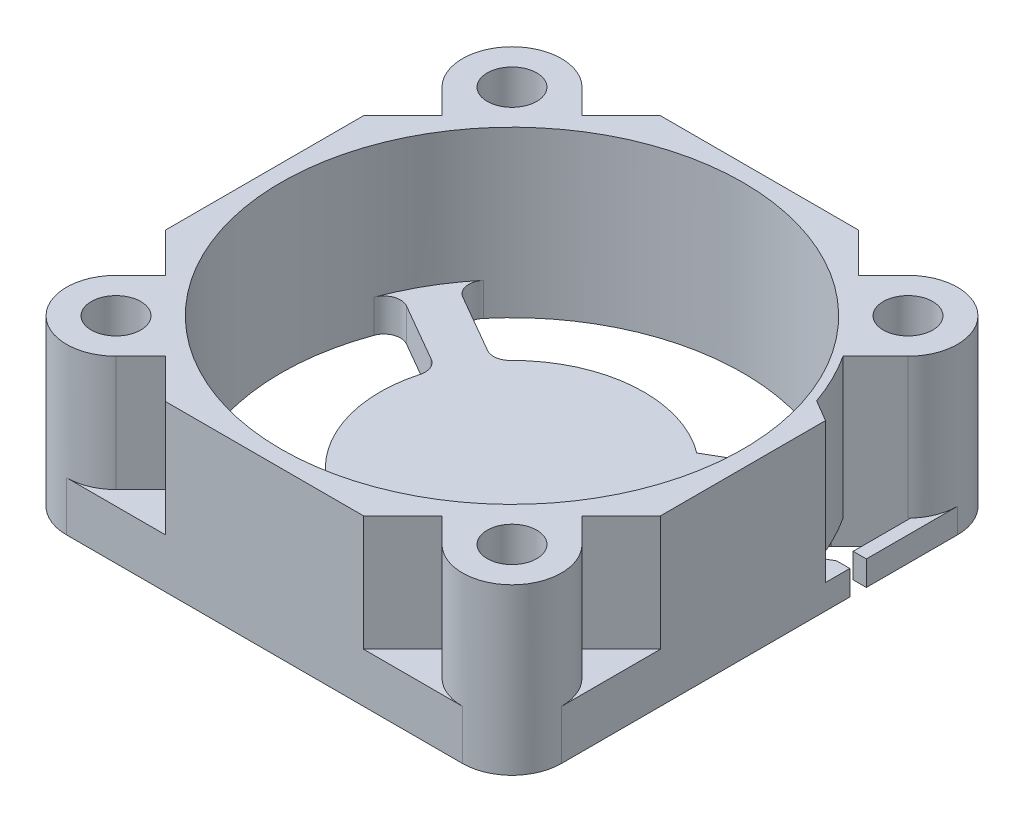
from build123d import *

# Parameters (mm, degrees)
SKETCH2_W           = 30
SKETCH2_H           = 30
BOSS_EXTRUDE1_DEPTH = 10
SKETCH3_R           = 1.5
CUT_EXTRUDE1_DEPTH  = 24.452078799
CUT_EXTRUDE5_DEPTH  = 7
CIRPATTERN2_COUNT   = 4
BOSS_EXTRUDE2_START = -2
SKETCH5_R           = 8
BOSS_EXTRUDE2_DEPTH = 2
BOSS_EXTRUDE3_START = -2
BOSS_EXTRUDE3_DEPTH = 2
FILLET1_R           = 1
FILLET2_R           = 1
CUT_EXTRUDE8_DEPTH  = 1.5
CUT_EXTRUDE9_DEPTH  = 23.852789764


with BuildPart() as part:
    # Sketch2 → Boss-Extrude1 (new body)
    with BuildSketch(Plane(origin=(0, 0, 0), x_dir=(1, 0, 0), z_dir=(0, 1, 0))):
        Rectangle(SKETCH2_W, SKETCH2_H)
    extrude(amount=BOSS_EXTRUDE1_DEPTH)

    # Sketch3 → Cut-Extrude1 (cut, through all)
    with BuildSketch(Plane(origin=(0, 10, 0), x_dir=(1, 0, 0), z_dir=(0, 1, 0))):
        with BuildLine():
            ThreePointArc((9.626607334, 10.165059333), (-12.860258603, -5.532969245), (14, 0))
            ThreePointArc((14, 0), (13.005976139, 5.181175993), (10.165059333, 9.626607334))
            ThreePointArc((10.165059333, 9.626607334), (9.878679656, 9.878679656), (9.626607334, 10.165059333))
        make_face()
        with BuildLine():
            Line((15, 15), (12, 15))
            ThreePointArc((12, 15), (14.121320344, 14.121320344), (15, 12))
            Line((15, 12), (15, 15))
        make_face()
        with Locations(Location((12, 12, 0), (0, 0, 270))):
            Circle(SKETCH3_R)
    cut_extrude1 = extrude(amount=-CUT_EXTRUDE1_DEPTH, mode=Mode.SUBTRACT)

    # Sketch3<3> → Cut-Extrude5 (cut)
    with BuildSketch(Plane(origin=(0, 10, 0), x_dir=(1, 0, 0), z_dir=(0, 1, 0))):
        with BuildLine():
            Line((15, 6), (15, 12))
            ThreePointArc((15, 12), (14.771638598, 10.851949703), (14.121320344, 9.878679656))
            Line((14.121320344, 9.878679656), (12.621320344, 8.378679656))
            Line((12.621320344, 8.378679656), (15, 6))
        make_face()
        with BuildLine():
            Line((8.378679656, 12.621320344), (9.878679656, 14.121320344))
            ThreePointArc((9.878679656, 14.121320344), (10.851949703, 14.771638598), (12, 15))
            Line((12, 15), (6, 15))
            Line((6, 15), (8.378679656, 12.621320344))
        make_face()
    cut_extrude5 = extrude(amount=-CUT_EXTRUDE5_DEPTH, mode=Mode.SUBTRACT)

    # CirPattern2: Cut-Extrude1, Cut-Extrude5 ×4 about axis
    cirpattern2_axis = Axis((0, 0, 0), (0, 1, 0))
    add([cut_extrude1.rotate(cirpattern2_axis, i * 360 / CIRPATTERN2_COUNT) for i in range(1, CIRPATTERN2_COUNT)], mode=Mode.SUBTRACT)
    add([cut_extrude5.rotate(cirpattern2_axis, i * 360 / CIRPATTERN2_COUNT) for i in range(1, CIRPATTERN2_COUNT)], mode=Mode.SUBTRACT)

    # Sketch5 → Boss-Extrude2 (add)
    with BuildSketch(Plane.XZ.offset(BOSS_EXTRUDE2_START)):
        Circle(SKETCH5_R)
        with BuildLine():
            Line((-1.25, 7.901740315), (-1.25, 13.944084767))
            ThreePointArc((-1.25, 13.944084767), (0, 14), (1.25, 13.944084767))
            Line((1.25, 13.944084767), (1.25, 7.901740315))
            Line((1.25, 7.901740315), (-1.25, 7.901740315))
        make_face()
        with BuildLine():
            Line((-6.218107847, -5.033401912), (-11.450931641, -8.054574138))
            ThreePointArc((-11.450931641, -8.054574138), (-12.124355653, -7), (-12.700931641, -5.889510629))
            Line((-12.700931641, -5.889510629), (-7.468107847, -2.868338403))
            Line((-7.468107847, -2.868338403), (-6.218107847, -5.033401912))
        make_face()
        with BuildLine():
            Line((4.800907132, -6.399319551), (10.244405826, -9.542124987))
            ThreePointArc((10.244405826, -9.542124987), (11.062646674, -8.580084415), (11.790860146, -7.548219459))
            Line((11.790860146, -7.548219459), (6.585131773, -4.542690781))
            Line((6.585131773, -4.542690781), (4.800907132, -6.399319551))
        make_face()
    extrude(amount=BOSS_EXTRUDE2_DEPTH)

    # Sketch13 → Boss-Extrude3 (add)
    with BuildSketch(Plane.XZ.offset(BOSS_EXTRUDE3_START)):
        with BuildLine():
            Line((8.467510381, -8.516233923), (11.717510381, -2.887068799))
            Line((11.717510381, -2.887068799), (13.449561188, -3.887068799))
            ThreePointArc((13.449561188, -3.887068799), (12.179734535, -6.903192498), (10.244405826, -9.542124987))
            Line((10.244405826, -9.542124987), (8.467510381, -8.516233923))
        make_face()
    extrude(amount=BOSS_EXTRUDE3_DEPTH)

    # Fillet1
    # the kernel refuses this fillet: 1 mm, written as the material it adds along each edge
    with BuildSketch(Plane(origin=(10.244405826, 2, -9.542124987), x_dir=(-0.716571272890301, 0, -0.6975138786206146), z_dir=(0, -1, 0))) as fillet1_piece_1:
        with BuildLine():
            CenterArc((1.321230175, -0.998801992), FILLET1_R, 87.19514232, 108.576976785)
            Line((0.3588798, -1.270613979), (0, 0))
            ThreePointArc((0, 0), (0.685082313, 0.01677211), (1.370164625, 0))
        make_face()
    extrude(amount=2)
    with BuildSketch(Plane(origin=(-1.25, 2, 13.944084767), x_dir=(0, 0, -1), z_dir=(0, -1, 0)), Plane(origin=(-11.450931641, 2, -8.054574138), x_dir=(0.8660254037844306, 0, 0.5000000000000138), z_dir=(0, -1, 0))) as fillet1_piece_2:
        with BuildLine():
            CenterArc((1.14027674, -1), FILLET1_R, 90, 99.9667663)
            ThreePointArc((0.15536843, -1.173076923), (0.065284688, -0.58818072), (0, 0))
            Line((0, 0), (1.14027674, 0))
        make_face()
    extrude(amount=2)
    with BuildSketch(Plane(origin=(-12.700931641, 2, -5.889510629), x_dir=(0.8660254037844369, 0, 0.5000000000000029), z_dir=(0, -1, 0)), Plane(origin=(1.25, 2, 13.944084767), x_dir=(0, 0, -1), z_dir=(0, -1, 0))) as fillet1_piece_3:
        with BuildLine():
            CenterArc((1.14027674, 1), FILLET1_R, 170.0332337, 99.9667663)
            ThreePointArc((0.15536843, 1.173076923), (0.065284688, 0.58818072), (0, 0))
            Line((0, 0), (1.14027674, 0))
        make_face()
    extrude(amount=2)

    # Fillet2
    fillet2_edges = [part.edges().sort_by_distance(p)[0] for p in [
        (-7.468107847, 1, -2.868338403),
        (1.25, 1, 7.901740315),
        (-1.25, 1, 7.901740315),
        (-6.218107847, 1, -5.033401912),
    ]]
    fillet(fillet2_edges, radius=FILLET2_R)

    # Sketch9 → Cut-Extrude8 (cut)
    with BuildSketch(Plane.XZ):
        Polygon((9.717510381, -6.351170414), (11.790860146, -7.548219459), (12.621320344, -8.378679656), (14.121320344, -9.878679656), (14.2, -9.957359313), (14.2, -6.475035387), (15, -6.475035387), (15, -5.475035387), (14.2, -5.475035387), (11.217510381, -3.753094203), align=None)
    extrude(amount=-CUT_EXTRUDE8_DEPTH, mode=Mode.SUBTRACT)

    # Sketch10 → Cut-Extrude9 (cut, through all)
    with BuildSketch(Plane.XZ.offset(-1.5)):
        with BuildLine():
            ThreePointArc((13.569384529, -5.110949375), (12.93687053, -6.548845767), (12.152521667, -7.90988098))
            Line((12.152521667, -7.90988098), (14.121320344, -9.878679656))
            Line((14.121320344, -9.878679656), (14.2, -9.957359313))
            Line((14.2, -9.957359313), (14.2, -6.475035387))
            Line((14.2, -6.475035387), (15, -6.475035387))
            Line((15, -6.475035387), (15, -5.475035387))
            Line((15, -5.475035387), (14.2, -5.475035387))
            Line((14.2, -5.475035387), (13.569384529, -5.110949375))
        make_face()
        with BuildLine():
            ThreePointArc((13.693819896, -4.767525213), (13.632683665, -4.939629144), (13.569384529, -5.110949375))
            Line((13.569384529, -5.110949375), (14.2, -5.475035387))
            Line((14.2, -5.475035387), (15, -5.475035387))
            Line((15, -5.475035387), (15, -4))
            Line((15, -4), (13.693819896, -4.767525213))
        make_face()
        with BuildLine():
            Line((14.2, -9.957359313), (14.121320344, -9.878679656))
            ThreePointArc((14.121320344, -9.878679656), (14.771638598, -10.851949703), (15, -12))
            Line((15, -12), (15, -6.475035387))
            Line((15, -6.475035387), (14.2, -6.475035387))
            Line((14.2, -6.475035387), (14.2, -9.957359313))
        make_face()
    extrude(amount=-CUT_EXTRUDE9_DEPTH, mode=Mode.SUBTRACT)


solid = part.part
